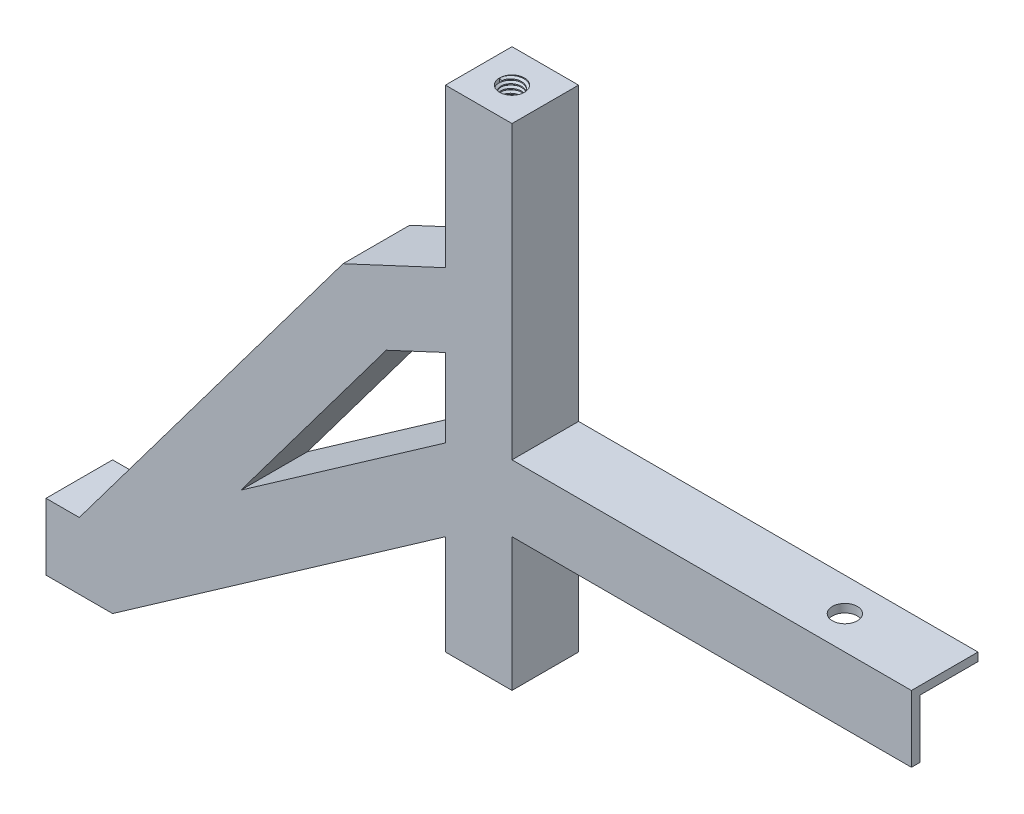
from build123d import *
from build123d.topology import SkipClean

# Parameters (mm, degrees)
SKETCH1_W               = 25.4
SKETCH1_H               = 25.4
SKETCH1_W_2             = 20.32
SKETCH1_H_2             = 20.32
SQ_TB_EXTRUDE_DEPTH     = 187.325
SKETCH3_W               = 20.32
SKETCH3_H               = 20.32
SKETCH3_R               = 4.7625
END_CAPS_DEPTH          = 6.35
TOP_THREAD_PITCH        = 1.5875
BOTTOM_THREAD_PITCH     = 1.5875
SQ_TB_ANGLES_DEPTH      = 12.7
SQ_TB_ANGLES_DEPTH_BACK = 12.7
BOSS_EXTRUDE2_DEPTH     = 152.4
SKETCH20_R              = 4.7625
CUT_EXTRUDE2_DEPTH      = 209.682294416
SKETCH21_R              = 9.525
CUT_EXTRUDE3_DEPTH      = 380.847404304


with BuildPart() as part:
    # Sketch1 → Sq_Tb Extrude (new body)
    with BuildSketch(Plane(origin=(0, 0, 0), x_dir=(1, 0, 0), z_dir=(0, 1, 0))):
        Rectangle(SKETCH1_W, SKETCH1_H)
        Rectangle(SKETCH1_W_2, SKETCH1_H_2, mode=Mode.SUBTRACT)
    extrude(amount=SQ_TB_EXTRUDE_DEPTH)

    # Sketch3 → End Caps (add)
    with BuildSketch(Plane(origin=(0, 187.325, 0), x_dir=(1, 0, 0), z_dir=(0, 1, 0))):
        Rectangle(SKETCH3_W, SKETCH3_H)
        with Locations(Location((0, 0, 0), (0, 0, 270))):
            Circle(SKETCH3_R, mode=Mode.SUBTRACT)
    end_caps = extrude(amount=-END_CAPS_DEPTH)

    # End Cap Mirror: End Caps across plane
    add(end_caps.mirror(Plane.ZX.offset(93.6625)))

    # Top Thread: arcs per turn and ends read off the stored shape
    # Top Thread: the profile of Thread Profile1 profile screwed along a right-hand helix through 4 turns, 8 arcs to a turn; built about Z, then put on its axis
    with SkipClean():  # the faces are left unmerged after this step: merging them gives an invalid solid
        top_thread_z = Axis((0, 0, 0), (0, 0, 1))
        top_thread_corners = [(4.7628, 0, -0.000173205), (4.7628, 0, 1.389235701), (3.903240423, 0, 0.892968748), (3.903240423, 0, 0.496093748)]
        with BuildLine(mode=Mode.PRIVATE) as top_thread_profile:
            Line(top_thread_corners[0], top_thread_corners[1])
            Line(top_thread_corners[1], top_thread_corners[2])
            Line(top_thread_corners[2], top_thread_corners[3])
            Line(top_thread_corners[3], top_thread_corners[0])
        top_thread_cap = Face(top_thread_profile.wire())
        top_thread_turn_angles = [0, 22.5, 45, 67.5, 90, 112.5, 135, 157.5, 180, 202.5, 225, 247.5, 270, 292.5, 315, 337.5, 360]
        top_thread_turn_weights = [1, 0.9238795325112867, 1, 0.9238795325112867, 1, 0.9238795325112867, 1, 0.9238795325112867, 1, 0.9238795325112867, 1, 0.9238795325112867, 1, 0.9238795325112867, 1, 0.9238795325112867, 1]
        top_thread_turn_rails = [Edge.make_bspline([Vector(p[0], p[1], 0).rotate(top_thread_z, top_thread_turn_angles[k]) / top_thread_turn_weights[k] + Vector(0, 0, p[2] + TOP_THREAD_PITCH * top_thread_turn_angles[k] / 360) for k in range(17)], [0, 0, 0, 1, 1, 2, 2, 3, 3, 4, 4, 5, 5, 6, 6, 7, 7, 8, 8, 8], 2, top_thread_turn_weights) for p in top_thread_corners]
        top_thread_turn_sides = [Face.make_surface_from_curves(top_thread_turn_rails[p[0]], top_thread_turn_rails[p[1]]) for p in [(0, 1), (1, 2), (2, 3), (3, 0)]]
        top_thread = Plane(origin=(0, 187.325, 0), x_dir=(-1, 0, 0), z_dir=(0, -1, 0)) * Solid(Shell([*[p.moved(Location((0, 0, TOP_THREAD_PITCH * i))) for i in range(4) for p in top_thread_turn_sides], top_thread_cap, top_thread_cap.rotate(top_thread_z, 1440).moved(Location((0, 0, TOP_THREAD_PITCH * 1440 / 360)))]))
        add(top_thread)

    # Bottom Thread: arcs per turn and ends read off the stored shape
    # Bottom Thread: the profile of Thread Profile2 profile screwed along a right-hand helix through 4 turns, 8 arcs to a turn; built about Z, then put on its axis
    with SkipClean():  # the faces are left unmerged after this step: merging them gives an invalid solid
        bottom_thread_z = Axis((0, 0, 0), (0, 0, 1))
        bottom_thread_corners = [(4.7628, 0, -0.000173205), (4.7628, 0, 1.389235701), (3.903240423, 0, 0.892968748), (3.903240423, 0, 0.496093748)]
        with BuildLine(mode=Mode.PRIVATE) as bottom_thread_profile:
            Line(bottom_thread_corners[0], bottom_thread_corners[1])
            Line(bottom_thread_corners[1], bottom_thread_corners[2])
            Line(bottom_thread_corners[2], bottom_thread_corners[3])
            Line(bottom_thread_corners[3], bottom_thread_corners[0])
        bottom_thread_cap = Face(bottom_thread_profile.wire())
        bottom_thread_turn_angles = [0, 22.5, 45, 67.5, 90, 112.5, 135, 157.5, 180, 202.5, 225, 247.5, 270, 292.5, 315, 337.5, 360]
        bottom_thread_turn_weights = [1, 0.9238795325112867, 1, 0.9238795325112867, 1, 0.9238795325112867, 1, 0.9238795325112867, 1, 0.9238795325112867, 1, 0.9238795325112867, 1, 0.9238795325112867, 1, 0.9238795325112867, 1]
        bottom_thread_turn_rails = [Edge.make_bspline([Vector(p[0], p[1], 0).rotate(bottom_thread_z, bottom_thread_turn_angles[k]) / bottom_thread_turn_weights[k] + Vector(0, 0, p[2] + BOTTOM_THREAD_PITCH * bottom_thread_turn_angles[k] / 360) for k in range(17)], [0, 0, 0, 1, 1, 2, 2, 3, 3, 4, 4, 5, 5, 6, 6, 7, 7, 8, 8, 8], 2, bottom_thread_turn_weights) for p in bottom_thread_corners]
        bottom_thread_turn_sides = [Face.make_surface_from_curves(bottom_thread_turn_rails[p[0]], bottom_thread_turn_rails[p[1]]) for p in [(0, 1), (1, 2), (2, 3), (3, 0)]]
        bottom_thread = Plane(origin=(0, 0, 0), x_dir=(1, 0, 0), z_dir=(0, 1, 0)) * Solid(Shell([*[p.moved(Location((0, 0, BOTTOM_THREAD_PITCH * i))) for i in range(4) for p in bottom_thread_turn_sides], bottom_thread_cap, bottom_thread_cap.rotate(bottom_thread_z, 1440).moved(Location((0, 0, BOTTOM_THREAD_PITCH * 1440 / 360)))]))
        add(bottom_thread)

    # Sketch9 → Sq_Tb Angles (add, two sides: drawn at the far end of the back side and taken through both)
    with SkipClean():  # the faces are left unmerged after this step: merging them gives an invalid solid
        with BuildSketch(Plane.XY.offset(-SQ_TB_ANGLES_DEPTH_BACK)):
            Polygon((-165.1, -25.4), (-152.4, -25.4), (-51.765309591, 108.779587212), (-12.7, 126.996040243), (-12.7, 98.970241101), (-35.263452032, 88.448730624), (-139.7, -50.8), (-165.1, -50.8), align=None)
            Polygon((-12.7, 69.094481668), (-90.752491523, 14.463344637), (-139.7, -50.8), (-12.7, 38.090876738), align=None)
        extrude(amount=SQ_TB_ANGLES_DEPTH + SQ_TB_ANGLES_DEPTH_BACK)

    # Sketch19 → Boss-Extrude2 (add)
    with SkipClean():  # the faces are left unmerged after this step: merging them gives an invalid solid
        with BuildSketch(Plane(origin=(12.7, 0, 0), x_dir=(0, 0, -1), z_dir=(1, 0, 0))):
            Polygon((12.7, 76.2), (-12.7, 76.2), (-12.7, 50.8), (-9.525, 50.8), (-9.525, 73.025), (12.7, 73.025), align=None)
        extrude(amount=BOSS_EXTRUDE2_DEPTH)

    # Sketch20 → Cut-Extrude2 (cut, through all)
    with SkipClean():  # the faces are left unmerged after this step: merging them gives an invalid solid
        with BuildSketch(Plane(origin=(0, 76.2, 0), x_dir=(1, 0, 0), z_dir=(0, 1, 0))):
            with Locations(Location((127, 0, 0), (0, 0, 270))):
                Circle(SKETCH20_R)
        extrude(amount=-CUT_EXTRUDE2_DEPTH, mode=Mode.SUBTRACT)

    # Sketch21 → Cut-Extrude3 (cut, through all)
    with SkipClean():  # the faces are left unmerged after this step: merging them gives an invalid solid
        with BuildSketch(Plane.ZY.offset(165.1)):
            with Locations((0, -38.1)):
                Circle(SKETCH21_R)
        extrude(amount=-CUT_EXTRUDE3_DEPTH, mode=Mode.SUBTRACT)


solid = part.part
